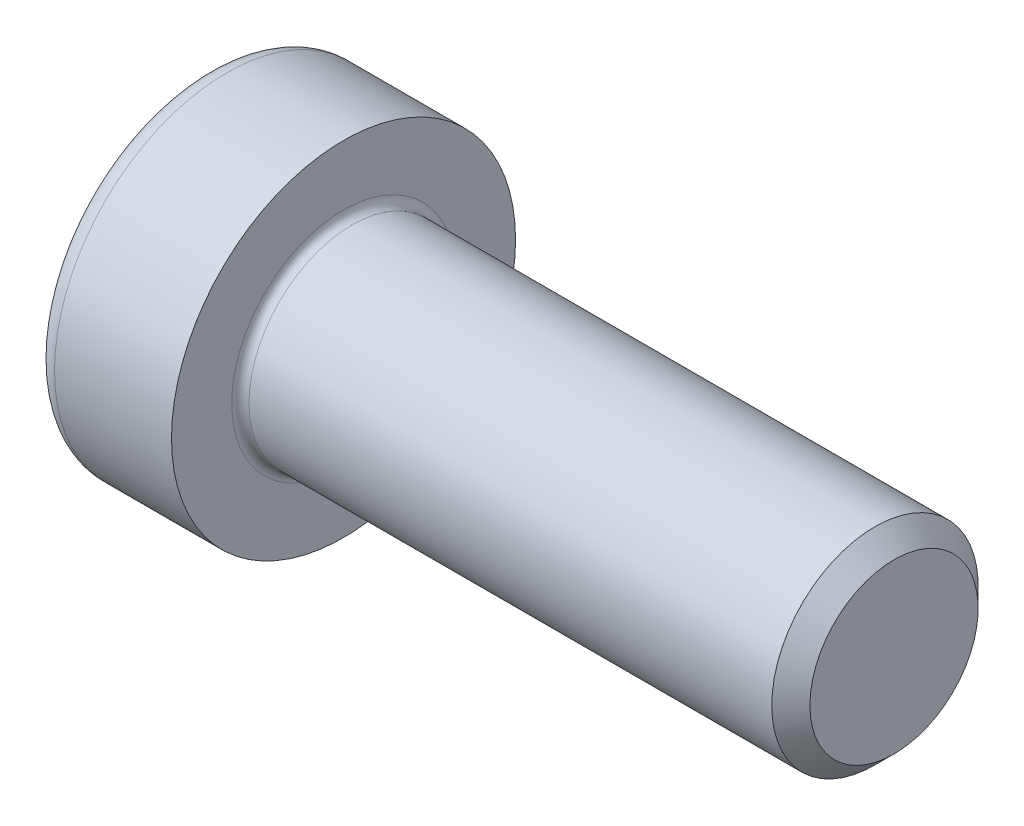
from build123d import *

# Parameters (mm, degrees)
FILLET1_R   = 0.25
FILLET2_R   = 0.6
HEX_2_DEPTH = 2.5


with BuildPart() as part:
    # BodySke → Base-Revolve (revolve)
    with BuildSketch(Plane.XY):
        Polygon((0, 0), (0, 5), (4, 5), (4, 3), (19.4455, 3), (20, 2.4455), (20, 0), align=None)
    revolve(axis=Axis((-31.75, 0, 0), (1, 0, 0)))

    # Fillet1
    fillet1_edges = [part.edges().sort_by_distance(p)[0] for p in [
        (4, -3, 0),
    ]]
    fillet(fillet1_edges, radius=FILLET1_R)

    # Fillet2
    fillet2_edges = [part.edges().sort_by_distance(p)[0] for p in [
        (0, -5, 0),
    ]]
    fillet(fillet2_edges, radius=FILLET2_R)

    # HexSke → Hex 2 (cut)
    with BuildSketch(Plane(origin=(0, 0, 0), x_dir=(0, 0.500000000000001, 0.866025403784438), z_dir=(-1, 0, 0))):
        Polygon((1.443375673, 2.5), (-1.443375673, 2.5), (-2.886751346, 0), (-1.443375673, -2.5), (1.443375673, -2.5), (2.886751346, 0), align=None)
    extrude(amount=-HEX_2_DEPTH, mode=Mode.SUBTRACT)

    # PilotSke → Hex-PreBroach (revolve, cut)
    with BuildSketch(Plane.XY):
        Polygon((0, 2.5), (2.5, 2.5), (3.077350269, 1.5), (5, 1.5), (5.866025404, 0), (0, 0), align=None)
    revolve(axis=Axis((0, 0, 0), (1, 0, 0)), mode=Mode.SUBTRACT)


solid = part.part
